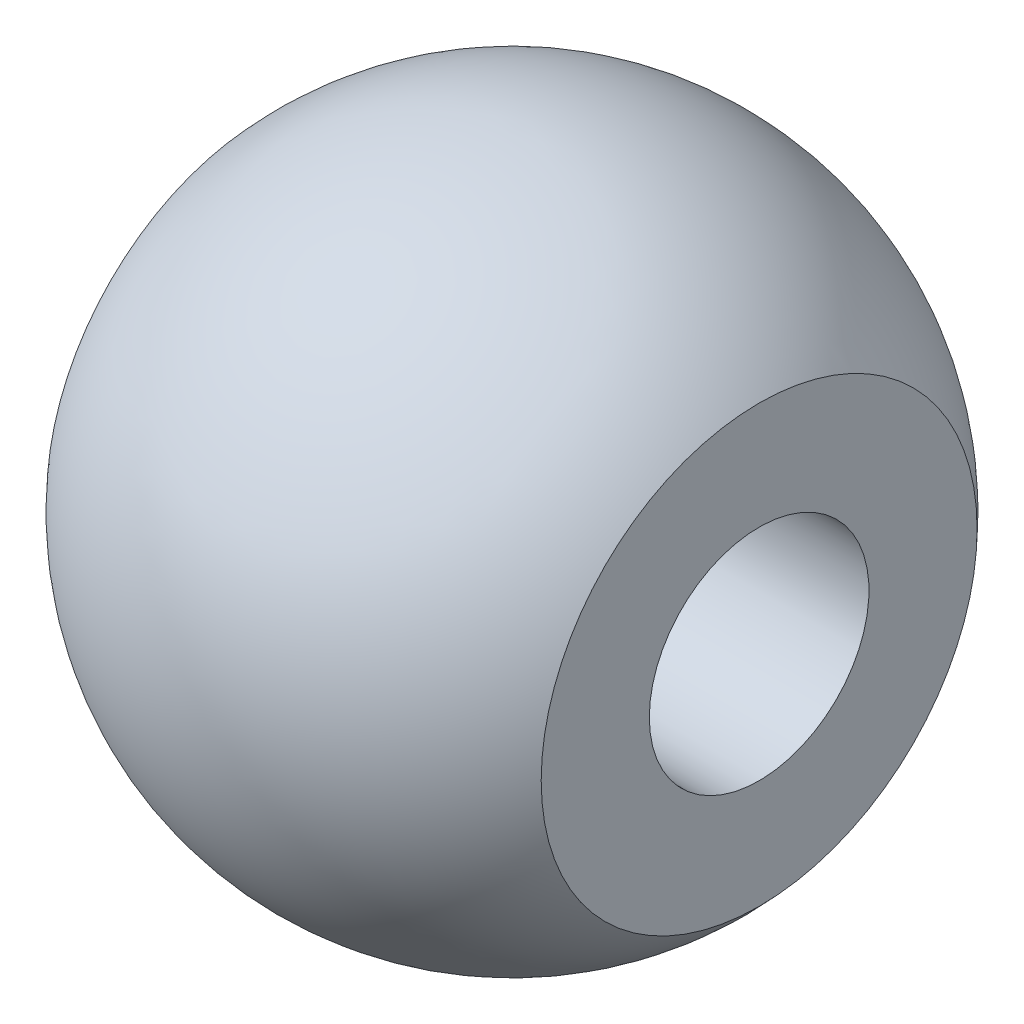
from build123d import *

# Parameters (mm, degrees)
CUT_EXTRUDE2_OUTLINE_W = 3
CUT_EXTRUDE2_OUTLINE_H = 14.95468232
CUT_EXTRUDE2_DEPTH     = 12
HOLE1_D                = 4
HOLE1_DEPTH            = 12
HOLE1_CSINK_D          = 5
HOLE1_CSINK_ANGLE      = 45


with BuildPart() as part:
    # Sketch1 → Revolve1 (revolve)
    with BuildSketch(Plane.XY):
        with BuildLine():
            Line((0, 0), (0, 12))
            ThreePointArc((0, 12), (-6, 6), (0, 0))
        make_face()
    revolve(axis=Axis((0, 0, 0), (0, 1, 0)))

    # Cut-Extrude2: read off the stored shape, not the designer's step
    # Cut-Extrude2 outline → Cut-Extrude2 (cut)
    with BuildSketch(Plane(origin=(0, 0, 0), x_dir=(1, 0, 0), z_dir=(0, 1, 0))):
        with Locations((-6, 0)):
            Rectangle(CUT_EXTRUDE2_OUTLINE_W, CUT_EXTRUDE2_OUTLINE_H)
    cut_extrude2 = extrude(amount=CUT_EXTRUDE2_DEPTH, mode=Mode.SUBTRACT)

    # Mirror2: Cut-Extrude2 across plane
    add(cut_extrude2.mirror(Plane(origin=(0, 0, 0), x_dir=(0, 0, 1), z_dir=(1, 0, 0))), mode=Mode.SUBTRACT)

    # Hole1
    with Locations(Plane.ZY.offset(4.5)):
        with Locations((0, 6.01212861)):
            CounterSinkHole(HOLE1_D / 2, HOLE1_CSINK_D / 2, depth=HOLE1_DEPTH, counter_sink_angle=HOLE1_CSINK_ANGLE)


solid = part.part
